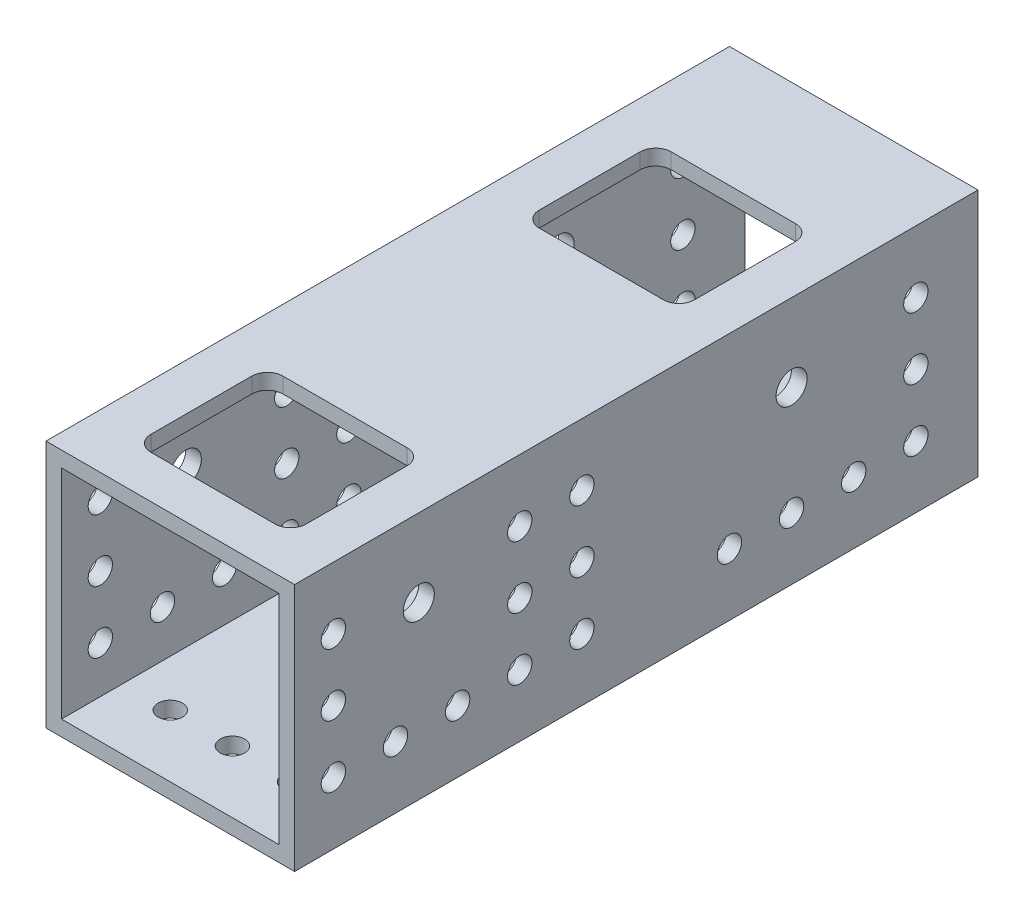
from build123d import *

# Parameters (mm, degrees)
SKETCH1_W               = 50.8
SKETCH1_H               = 50.8
BOSS_EXTRUDE1_DEPTH     = 69.85
SHELL1_T                = -3.175
SKETCH2_W               = 31.75
SKETCH2_H               = 26.9875
CUT_EXTRUDE1_DEPTH      = 79.545162168
FILLET1_R               = 3.175
CUT_EXTRUDE2_DEPTH      = 79.545162168
CUT_EXTRUDE2_DEPTH_BACK = 79.545162168
SKETCH3_R               = 3.175
CUT_EXTRUDE3_DEPTH      = 79.545162168
CUT_EXTRUDE3_DEPTH_BACK = 79.545162168
SKETCH4_R               = 2.4892
CUT_EXTRUDE4_DEPTH      = 79.545162168
CUT_EXTRUDE4_DEPTH_BACK = 79.545162168
SKETCH5_R               = 2.4892
FILLET2_R               = 3.175


with BuildPart() as part:
    # Sketch1 → Boss-Extrude1 (new, symmetric)
    with BuildSketch(Plane.XY):
        Rectangle(SKETCH1_W, SKETCH1_H)
    extrude(amount=BOSS_EXTRUDE1_DEPTH, both=True)

    # Shell1
    shell1_openings = [part.faces().sort_by_distance(p)[0] for p in [
        (0, 0, -69.85),
        (0, 0, 69.85),
    ]]
    offset(amount=SHELL1_T, openings=shell1_openings, kind=Kind.INTERSECTION)

    # Sketch2 → Cut-Extrude1 (cut, through all)
    with BuildSketch(Plane(origin=(0, 0, 0), x_dir=(1, 0, 0), z_dir=(0, 1, 0))):
        with Locations((0, 31.75)):
            Rectangle(SKETCH2_W, SKETCH2_H)
        with Locations((0, -47.625)):
            Rectangle(SKETCH2_W, SKETCH2_H)
    extrude(amount=CUT_EXTRUDE1_DEPTH, mode=Mode.SUBTRACT)

    # Fillet1
    fillet1_edges = [part.edges().sort_by_distance(p)[0] for p in [
        (15.875, 23.8125, -45.24375),
        (-15.875, 23.8125, -45.24375),
        (-15.875, 23.8125, -18.25625),
        (15.875, 23.8125, -18.25625),
    ]]
    fillet(fillet1_edges, radius=FILLET1_R)

    # Sketch3 → Cut-Extrude2 (cut, two sides: drawn at the far end of the back side and taken through both)
    with BuildSketch(Plane(origin=(0, 0, 0), x_dir=(0, 0, -1), z_dir=(1, 0, 0)).offset(-CUT_EXTRUDE2_DEPTH_BACK)):
        with Locations((31.75, 9.525)):
            Circle(SKETCH3_R)
        with Locations((-44.45, 9.525)):
            Circle(SKETCH3_R)
    extrude(amount=CUT_EXTRUDE2_DEPTH + CUT_EXTRUDE2_DEPTH_BACK, mode=Mode.SUBTRACT)

    # Sketch4 → Cut-Extrude3 (cut, two sides: drawn at the far end of the back side and taken through both)
    with BuildSketch(Plane(origin=(0, 0, 0), x_dir=(0, 0, -1), z_dir=(1, 0, 0)).offset(-CUT_EXTRUDE3_DEPTH_BACK)):
        with Locations((57.15, 12.7)):
            Circle(SKETCH4_R)
        with Locations((44.45, -12.7)):
            Circle(SKETCH4_R)
        with Locations((31.75, -12.7)):
            Circle(SKETCH4_R)
        with Locations((19.05, -12.7)):
            Circle(SKETCH4_R)
        with Locations((57.15, 0)):
            Circle(SKETCH4_R)
        with Locations((57.15, -12.7)):
            Circle(SKETCH4_R)
        with Locations((-61.9125, 12.7)):
            Circle(SKETCH4_R)
        with Locations((-23.8125, 12.7)):
            Circle(SKETCH4_R)
        with Locations((-11.1125, 12.7)):
            Circle(SKETCH4_R)
        with Locations((-23.8125, 0)):
            Circle(SKETCH4_R)
        with Locations((-11.1125, 0)):
            Circle(SKETCH4_R)
        with Locations((-49.2125, -12.7)):
            Circle(SKETCH4_R)
        with Locations((-36.5125, -12.7)):
            Circle(SKETCH4_R)
        with Locations((-23.8125, -12.7)):
            Circle(SKETCH4_R)
        with Locations((-11.1125, -12.7)):
            Circle(SKETCH4_R)
        with Locations((-61.9125, 0)):
            Circle(SKETCH4_R)
        with Locations((-61.9125, -12.7)):
            Circle(SKETCH4_R)
    extrude(amount=CUT_EXTRUDE3_DEPTH + CUT_EXTRUDE3_DEPTH_BACK, mode=Mode.SUBTRACT)

    # Sketch5 → Cut-Extrude4 (cut, two sides: drawn at the far end of the back side and taken through both)
    with BuildSketch(Plane(origin=(0, 0, 0), x_dir=(1, 0, 0), z_dir=(0, 1, 0)).offset(-CUT_EXTRUDE4_DEPTH_BACK)):
        with Locations((-12.7, -57.15)):
            Circle(SKETCH5_R)
        with Locations((0, -57.15)):
            Circle(SKETCH5_R)
        with Locations((12.7, -57.15)):
            Circle(SKETCH5_R)
    extrude(amount=CUT_EXTRUDE4_DEPTH + CUT_EXTRUDE4_DEPTH_BACK, mode=Mode.SUBTRACT)

    # Fillet2
    fillet2_edges = [part.edges().sort_by_distance(p)[0] for p in [
        (-15.875, 23.8125, 34.13125),
        (-15.875, 23.8125, 61.11875),
        (15.875, 23.8125, 61.11875),
        (15.875, 23.8125, 34.13125),
    ]]
    fillet(fillet2_edges, radius=FILLET2_R)


solid = part.part
